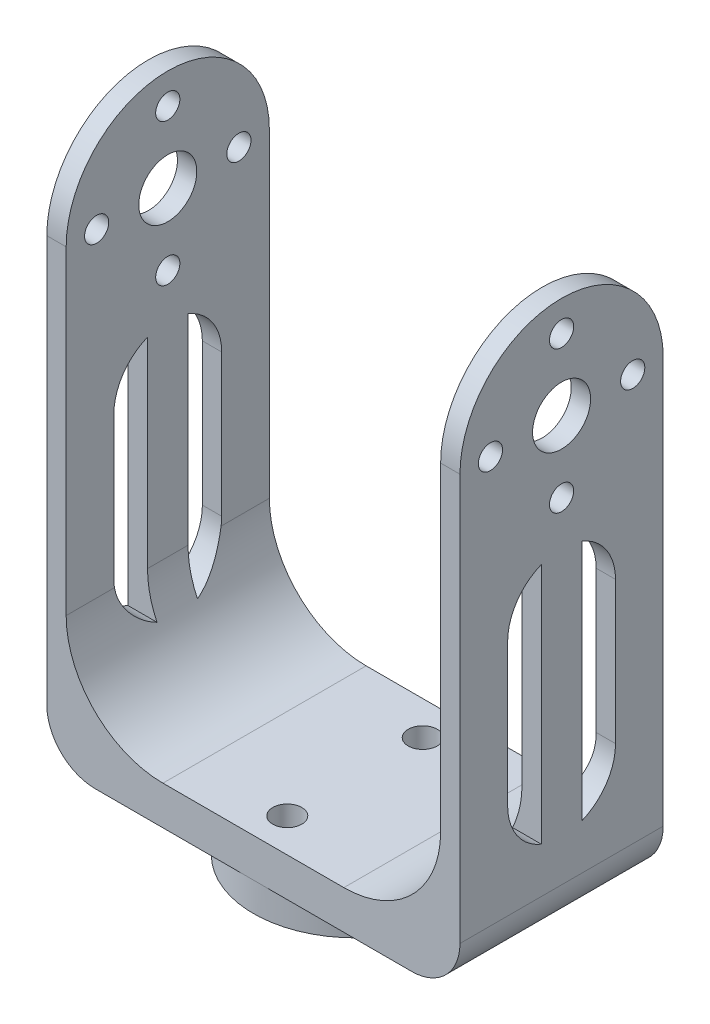
from build123d import *
from build123d.topology import SkipClean

# Parameters (mm, degrees)
SKETCH_1_W           = 42.7
SKETCH_1_H           = 21
SKETCH_1_R           = 1.5
EXTRUDE_1_DEPTH      = 2
SKETCH_2_R           = 1.25
SKETCH_2_R_2         = 3
EXTRUDE_2_DEPTH      = 2
EXTRUDE_3_DEPTH      = 1
EXTRUDE_3_DEPTH_BACK = 3
SKETCH_3_W           = 42.7
SKETCH_3_H           = 21
SKETCH_4_R           = 10.5
SKETCH_4_R_2         = 1.5
EXTRUDE_4_DEPTH      = 3
FILLET_1_R           = 10
FILLET_2_R           = 5
CUT_EXTRUDE_START    = -4
SKETCH_6_R           = 1.5
CUT_EXTRUDE_1_DEPTH  = 4


with BuildPart() as part:
    # 草图1 → 凸台-拉伸1 (new body)
    with BuildSketch(Plane(origin=(0, 0, 0), x_dir=(1, 0, 0), z_dir=(0, 1, 0))):
        Rectangle(SKETCH_1_W, SKETCH_1_H)
        with Locations(Location((7.5, 5, 0), (0, 0, 270))):
            Circle(SKETCH_1_R, mode=Mode.SUBTRACT)
        with Locations(Location((7.5, -5, 0), (0, 0, 90))):
            Circle(SKETCH_1_R, mode=Mode.SUBTRACT)
        with Locations(Location((-7.5, -5, 0), (0, 0, 270))):
            Circle(SKETCH_1_R, mode=Mode.SUBTRACT)
        with Locations(Location((-7.5, 5, 0), (0, 0, 90))):
            Circle(SKETCH_1_R, mode=Mode.SUBTRACT)
        with BuildLine():
            Line((8.017950723, 1.550908082), (12.912587519, 1.550908082))
            ThreePointArc((12.912587519, 1.550908082), (14.126270768, 1.145131224), (14.697546856, 0))
            ThreePointArc((14.697546856, 0), (14.126270768, -1.145131224), (12.912587519, -1.550908082))
            Line((12.912587519, -1.550908082), (8.017950723, -1.550908082))
            add(Edge.make_bspline(
                [(0, -7.407271614), (2.092471107, -7.358009404), (3.043739342, -2.951912586), (6.007732496, -1.626733157), (8.017950723, -1.550908082)],
                knots=[0, 0, 0, 0, 0.496822763, 1, 1, 1, 1], degree=3))
            add(Edge.make_bspline(
                [(0, -7.407271614), (-2.092471107, -7.358009404), (-3.043739342, -2.951912586), (-6.007732496, -1.626733157), (-8.017950723, -1.550908082)],
                knots=[0, 0, 0, 0, 0.496822763, 1, 1, 1, 1], degree=3))
            Line((-8.017950723, -1.550908082), (-12.912587519, -1.550908082))
            ThreePointArc((-12.912587519, -1.550908082), (-14.126270768, -1.145131224), (-14.697546856, 0))
            ThreePointArc((-14.697546856, 0), (-14.126270768, 1.145131224), (-12.912587519, 1.550908082))
            Line((-12.912587519, 1.550908082), (-8.017950723, 1.550908082))
            add(Edge.make_bspline(
                [(0, 7.407271614), (-2.092471107, 7.358009404), (-3.043739342, 2.951912586), (-6.007732496, 1.626733157), (-8.017950723, 1.550908082)],
                knots=[0, 0, 0, 0, 0.496822763, 1, 1, 1, 1], degree=3))
            add(Edge.make_bspline(
                [(0, 7.407271614), (2.092471107, 7.358009404), (3.043739342, 2.951912586), (6.007732496, 1.626733157), (8.017950723, 1.550908082)],
                knots=[0, 0, 0, 0, 0.496822763, 1, 1, 1, 1], degree=3))
        make_face(mode=Mode.SUBTRACT)
    extrude(amount=EXTRUDE_1_DEPTH)

    # 草图2 → 凸台-拉伸2 (add)
    with BuildSketch(Plane.ZY.offset(21.35)):
        with BuildLine():
            Line((-10.5, 2), (-10.5, 46))
            ThreePointArc((-10.5, 46), (0, 56.5), (10.5, 46))
            Line((10.5, 46), (10.5, 2))
            Line((10.5, 2), (-10.5, 2))
        make_face()
        with Locations((0, 38.65)):
            Circle(SKETCH_2_R, mode=Mode.SUBTRACT)
        with Locations((-7.35, 46)):
            Circle(SKETCH_2_R, mode=Mode.SUBTRACT)
        with Locations((0, 53.35)):
            Circle(SKETCH_2_R, mode=Mode.SUBTRACT)
        with Locations((7.35, 46)):
            Circle(SKETCH_2_R, mode=Mode.SUBTRACT)
        with Locations((0, 46)):
            Circle(SKETCH_2_R_2, mode=Mode.SUBTRACT)
        with BuildLine():
            Line((-2.091438456, 33.71946821), (-2.091438456, 8.682620376))
            ThreePointArc((-2.091438456, 8.682620376), (-4.622608783, 10.734209017), (-5.574745456, 13.850179963))
            Line((-5.574745456, 13.850179963), (-5.574745456, 28.551908623))
            ThreePointArc((-5.574745456, 28.551908623), (-4.622608783, 31.667879569), (-2.091438456, 33.71946821))
        make_face(mode=Mode.SUBTRACT)
        with BuildLine():
            Line((5.574745456, 28.551908623), (5.574745456, 13.850179963))
            ThreePointArc((5.574745456, 13.850179963), (4.622608783, 10.734209017), (2.091438456, 8.682620376))
            Line((2.091438456, 8.682620376), (2.091438456, 33.71946821))
            ThreePointArc((2.091438456, 33.71946821), (4.622608783, 31.667879569), (5.574745456, 28.551908623))
        make_face(mode=Mode.SUBTRACT)
    extrude_2 = extrude(amount=-EXTRUDE_2_DEPTH)

    # 镜向1: 凸台-拉伸2 across plane
    add(extrude_2.mirror(Plane(origin=(0, 0, 0), x_dir=(0, 0, 1), z_dir=(1, 0, 0))))

    # 草图3 → 凸台-拉伸3 (add, two sides: drawn at the far end of the back side and taken through both)
    with BuildSketch(Plane.XZ.offset(-EXTRUDE_3_DEPTH_BACK)):
        Rectangle(SKETCH_3_W, SKETCH_3_H)
    extrude(amount=EXTRUDE_3_DEPTH + EXTRUDE_3_DEPTH_BACK)

    # 草图4 → 凸台-拉伸4 (add)
    with BuildSketch(Plane.XZ.offset(1)):
        with Locations(Location((0, 0, 0), (0, 0, 270))):
            Circle(SKETCH_4_R)
        with Locations(Location((0, 7, 0), (0, 0, 270))):
            Circle(SKETCH_4_R_2, mode=Mode.SUBTRACT)
        with Locations(Location((0, -7, 0), (0, 0, 270))):
            Circle(SKETCH_4_R_2, mode=Mode.SUBTRACT)
    extrude(amount=EXTRUDE_4_DEPTH)

    # 圆角1
    # the kernel refuses this fillet: 10 mm, written as the material it adds along each edge
    with BuildSketch(Plane(origin=(19.35, 3, -10.5), x_dir=(-1, 0, 0), z_dir=(0, 0, 1))) as fillet_1_piece_1_section:
        with BuildLine():
            CenterArc((FILLET_1_R, -FILLET_1_R), FILLET_1_R, 90, 90)
            Line((0, -FILLET_1_R), (0, 0))
            Line((0, 0), (FILLET_1_R, 0))
        make_face()
    fillet_1_piece_1 = extrude(amount=21, mode=Mode.PRIVATE)
    fillet_1_piece_1 = fillet_1_piece_1 - Plane(origin=(17.043313865, 13.850179963, 0), x_dir=(0, 0, 1), z_dir=(1, 0, 0)) * Cylinder(5.574745456, 82, mode=Mode.PRIVATE)
    fillet_1_piece_1 = split(fillet_1_piece_1, bisect_by=Plane(origin=(17.043313865, 5.15733044, -2.091438456), z_dir=(0, 0, -1)), keep=Keep.TOP, mode=Mode.PRIVATE)
    add(fillet_1_piece_1)
    with BuildSketch(Plane(origin=(19.35, 3, -10.5), x_dir=(-1, 0, 0), z_dir=(0, 0, 1))) as fillet_1_piece_2_section:
        with BuildLine():
            CenterArc((FILLET_1_R, -FILLET_1_R), FILLET_1_R, 90, 90)
            Line((0, -FILLET_1_R), (0, 0))
            Line((0, 0), (FILLET_1_R, 0))
        make_face()
    fillet_1_piece_2 = extrude(amount=21, mode=Mode.PRIVATE)
    fillet_1_piece_2 = split(fillet_1_piece_2, bisect_by=Plane(origin=(16.850424397, 4.734237848, 2.091438456), z_dir=(0, 0, -1)), keep=Keep.TOP, mode=Mode.PRIVATE)
    fillet_1_piece_2 = fillet_1_piece_2 - Plane(origin=(16.850424397, 13.850179963, 0), x_dir=(0, 0, 1), z_dir=(1, 0, 0)) * Cylinder(5.574745456, 82, mode=Mode.PRIVATE)
    fillet_1_piece_2 = split(fillet_1_piece_2, bisect_by=Plane(origin=(16.850424397, 4.734237848, -2.091438456), z_dir=(0, 0, 1)), keep=Keep.TOP, mode=Mode.PRIVATE)
    add(fillet_1_piece_2)
    with BuildSketch(Plane(origin=(19.35, 3, -10.5), x_dir=(-1, 0, 0), z_dir=(0, 0, 1))) as fillet_1_piece_3_section:
        with BuildLine():
            CenterArc((FILLET_1_R, -FILLET_1_R), FILLET_1_R, 90, 90)
            Line((0, -FILLET_1_R), (0, 0))
            Line((0, 0), (FILLET_1_R, 0))
        make_face()
    fillet_1_piece_3 = extrude(amount=21, mode=Mode.PRIVATE)
    fillet_1_piece_3 = split(fillet_1_piece_3, bisect_by=Plane(origin=(19.170455524, 9.949953682, 2.091438456), z_dir=(0, 0, -1)), keep=Keep.TOP, mode=Mode.PRIVATE)
    fillet_1_piece_3 = fillet_1_piece_3 & Plane(origin=(19.170455524, 13.850179963, 0), x_dir=(0, 0, 1), z_dir=(1, 0, 0)) * Cylinder(5.574745456, 82, mode=Mode.PRIVATE)
    fillet_1_piece_3 = split(fillet_1_piece_3, bisect_by=Plane(origin=(19.170455524, 9.949953682, -2.091438456), z_dir=(0, 0, 1)), keep=Keep.TOP, mode=Mode.PRIVATE)
    add(fillet_1_piece_3)
    with BuildSketch(Plane(origin=(19.35, 3, -10.5), x_dir=(-1, 0, 0), z_dir=(0, 0, 1))) as fillet_1_piece_4_section:
        with BuildLine():
            CenterArc((FILLET_1_R, -FILLET_1_R), FILLET_1_R, 90, 90)
            Line((0, -FILLET_1_R), (0, 0))
            Line((0, 0), (FILLET_1_R, 0))
        make_face()
    fillet_1_piece_4 = extrude(amount=21, mode=Mode.PRIVATE)
    fillet_1_piece_4 = split(fillet_1_piece_4, bisect_by=Plane(origin=(17.043313289, 5.157330644, 2.091438456), z_dir=(0, 0, 1)), keep=Keep.TOP, mode=Mode.PRIVATE)
    fillet_1_piece_4 = fillet_1_piece_4 - Plane(origin=(17.043313289, 13.850179963, 0), x_dir=(0, 0, 1), z_dir=(1, 0, 0)) * Cylinder(5.574745456, 82, mode=Mode.PRIVATE)
    add(fillet_1_piece_4)
    with BuildSketch(Plane(origin=(-19.35, 3, -10.5), x_dir=(0, 1, 0), z_dir=(0, 0, 1))) as fillet_1_piece_5_section:
        with BuildLine():
            CenterArc((FILLET_1_R, -FILLET_1_R), FILLET_1_R, 90, 90)
            Line((0, -FILLET_1_R), (0, 0))
            Line((0, 0), (FILLET_1_R, 0))
        make_face()
    fillet_1_piece_5 = extrude(amount=21, mode=Mode.PRIVATE)
    fillet_1_piece_5 = fillet_1_piece_5 - Plane(origin=(-17.043313718, 13.850179963, 0), x_dir=(0, 0, 1), z_dir=(-1, 0, 0)) * Cylinder(5.574745456, 82, mode=Mode.PRIVATE)
    fillet_1_piece_5 = split(fillet_1_piece_5, bisect_by=Plane(origin=(-17.043313718, 5.157330569, -2.091438456), z_dir=(0, 0, -1)), keep=Keep.TOP, mode=Mode.PRIVATE)
    add(fillet_1_piece_5)
    with BuildSketch(Plane(origin=(-19.35, 3, -10.5), x_dir=(0, 1, 0), z_dir=(0, 0, 1))) as fillet_1_piece_6_section:
        with BuildLine():
            CenterArc((FILLET_1_R, -FILLET_1_R), FILLET_1_R, 90, 90)
            Line((0, -FILLET_1_R), (0, 0))
            Line((0, 0), (FILLET_1_R, 0))
        make_face()
    fillet_1_piece_6 = extrude(amount=21, mode=Mode.PRIVATE)
    fillet_1_piece_6 = split(fillet_1_piece_6, bisect_by=Plane(origin=(-16.850424159, 4.734237852, 2.091438456), z_dir=(0, 0, -1)), keep=Keep.TOP, mode=Mode.PRIVATE)
    fillet_1_piece_6 = fillet_1_piece_6 - Plane(origin=(-16.850424159, 13.850179963, 0), x_dir=(0, 0, 1), z_dir=(-1, 0, 0)) * Cylinder(5.574745456, 82, mode=Mode.PRIVATE)
    fillet_1_piece_6 = split(fillet_1_piece_6, bisect_by=Plane(origin=(-16.850424159, 4.734237852, -2.091438456), z_dir=(0, 0, 1)), keep=Keep.TOP, mode=Mode.PRIVATE)
    add(fillet_1_piece_6)
    with BuildSketch(Plane(origin=(-19.35, 3, -10.5), x_dir=(0, 1, 0), z_dir=(0, 0, 1))) as fillet_1_piece_7_section:
        with BuildLine():
            CenterArc((FILLET_1_R, -FILLET_1_R), FILLET_1_R, 90, 90)
            Line((0, -FILLET_1_R), (0, 0))
            Line((0, 0), (FILLET_1_R, 0))
        make_face()
    fillet_1_piece_7 = extrude(amount=21, mode=Mode.PRIVATE)
    fillet_1_piece_7 = split(fillet_1_piece_7, bisect_by=Plane(origin=(-17.043313652, 5.157330325, 2.091438456), z_dir=(0, 0, 1)), keep=Keep.TOP, mode=Mode.PRIVATE)
    fillet_1_piece_7 = fillet_1_piece_7 - Plane(origin=(-17.043313652, 13.850179963, 0), x_dir=(0, 0, 1), z_dir=(-1, 0, 0)) * Cylinder(5.574745456, 82, mode=Mode.PRIVATE)
    add(fillet_1_piece_7)
    with BuildSketch(Plane(origin=(-19.35, 3, -10.5), x_dir=(0, 1, 0), z_dir=(0, 0, 1))) as fillet_1_piece_8_section:
        with BuildLine():
            CenterArc((FILLET_1_R, -FILLET_1_R), FILLET_1_R, 90, 90)
            Line((0, -FILLET_1_R), (0, 0))
            Line((0, 0), (FILLET_1_R, 0))
        make_face()
    fillet_1_piece_8 = extrude(amount=21, mode=Mode.PRIVATE)
    fillet_1_piece_8 = split(fillet_1_piece_8, bisect_by=Plane(origin=(-19.170455532, 9.949953694, 2.091438456), z_dir=(0, 0, -1)), keep=Keep.TOP, mode=Mode.PRIVATE)
    fillet_1_piece_8 = fillet_1_piece_8 & Plane(origin=(-19.170455532, 13.850179963, 0), x_dir=(0, 0, 1), z_dir=(-1, 0, 0)) * Cylinder(5.574745456, 82, mode=Mode.PRIVATE)
    fillet_1_piece_8 = split(fillet_1_piece_8, bisect_by=Plane(origin=(-19.170455532, 9.949953694, -2.091438456), z_dir=(0, 0, 1)), keep=Keep.TOP, mode=Mode.PRIVATE)
    add(fillet_1_piece_8)

    # 圆角2
    fillet_2_edges = [part.edges().sort_by_distance(p)[0] for p in [
        (-21.35, -1, 0),
        (21.35, -1, 0),
    ]]
    fillet(fillet_2_edges, radius=FILLET_2_R)

    # 草图6 → 切除-拉伸1 (cut)
    with SkipClean():  # the faces are left unmerged after this step: merging them gives an invalid solid
        with BuildSketch(Plane.XZ.offset(1).offset(CUT_EXTRUDE_START)):
            with Locations(Location((0, 7, 0), (0, 0, 270))):
                Circle(SKETCH_6_R)
            with Locations(Location((0, -7, 0), (0, 0, 270))):
                Circle(SKETCH_6_R)
        extrude(amount=CUT_EXTRUDE_1_DEPTH, mode=Mode.SUBTRACT)


solid = part.part
